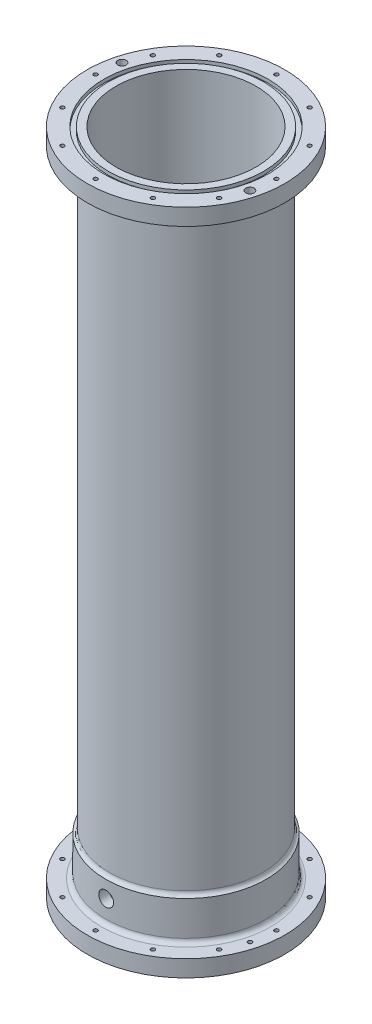
from build123d import *

# Parameters (mm, degrees)
SKETCH2_R               = 43.815
SKETCH2_R_2             = 40
BASE_CYLINDER_DEPTH     = 381
SKETCH3_R               = 56.35625
SKETCH3_R_2             = 40
AFT_FLANGE_DEPTH        = 9.525
SKETCH6_R               = 46.9011
SKETCH6_R_2             = 44.2849
AFT_O_RING_DEPTH        = 1.9812
SKETCH33_R              = 45.72
SKETCH33_R_2            = 43.815
CRITICALBOSS_DEPTH      = 22.225
FILLET1_R               = 2.54
BOLT_CIRCLE_D           = 2.2606
BOLT_CIRCLE_DEPTH       = 381
HOLE1_D                 = 2.38125
HOLE1_DEPTH             = 381
HOLE1_CBORE_D           = 4.7625
HOLE1_CBORE_DEPTH       = 4.7625
F_3_8_24_TAPPED_HOLE1_D = 8.4328
FILLET2_R               = 2.54


with BuildPart() as part:
    # Sketch2 → Base Cylinder (new body)
    with BuildSketch(Plane(origin=(0, 0, 0), x_dir=(1, 0, 0), z_dir=(0, 1, 0))):
        with Locations(Location((0, 0, 0), (0, 0, 270))):
            Circle(SKETCH2_R)
        with Locations(Location((0, 0, 0), (0, 0, 270))):
            Circle(SKETCH2_R_2, mode=Mode.SUBTRACT)
    extrude(amount=BASE_CYLINDER_DEPTH)

    # Sketch3 → Aft Flange (add)
    with BuildSketch(Plane.XZ):
        with Locations(Location((0, 0, 0), (0, 0, 270))):
            Circle(SKETCH3_R)
        with Locations(Location((0, 0, 0), (0, 0, 90))):
            Circle(SKETCH3_R_2, mode=Mode.SUBTRACT)
    aft_flange = extrude(amount=-AFT_FLANGE_DEPTH)

    # Sketch6 → Aft O-Ring (cut)
    with BuildSketch(Plane.XZ):
        with Locations(Location((0, 0, 0), (0, 0, 270))):
            Circle(SKETCH6_R)
        with Locations(Location((0, 0, 0), (0, 0, 270))):
            Circle(SKETCH6_R_2, mode=Mode.SUBTRACT)
    aft_o_ring = extrude(amount=-AFT_O_RING_DEPTH, mode=Mode.SUBTRACT)

    # Sketch33 → CriticalBoss (add)
    with BuildSketch(Plane(origin=(0, 9.525, 0), x_dir=(1, 0, 0), z_dir=(0, 1, 0))):
        with Locations(Location((0, 0, 0), (0, 0, 90))):
            Circle(SKETCH33_R)
        with Locations(Location((0, 0, 0), (0, 0, 270))):
            Circle(SKETCH33_R_2, mode=Mode.SUBTRACT)
    extrude(amount=CRITICALBOSS_DEPTH)

    # Fillet1
    # the kernel refuses this fillet: 2.54 mm, written as the material it adds along each edge
    with BuildSketch(Plane(origin=(0, 9.525, 0), x_dir=(0, 0, -1), z_dir=(1, 0, 0))) as fillet1_piece_1:
        with BuildLine():
            CenterArc((45.72 + FILLET1_R, FILLET1_R), FILLET1_R, 180, 90)
            Line((45.72, FILLET1_R), (45.72 - FILLET1_R * 0.02, FILLET1_R))
            Line((45.72 - FILLET1_R * 0.02, FILLET1_R), (45.72 - FILLET1_R * 0.02, -FILLET1_R * 0.02))
            Line((45.72 - FILLET1_R * 0.02, -FILLET1_R * 0.02), (45.72 + FILLET1_R, -FILLET1_R * 0.02))
            Line((45.72 + FILLET1_R, -FILLET1_R * 0.02), (45.72 + FILLET1_R, 0))
        make_face()
    revolve(axis=Axis((0, 9.525, 0), (0, 1, 0)))
    with BuildSketch(Plane(origin=(0, 31.75, 0), x_dir=(0, 0, 1), z_dir=(-1, 0, 0))) as fillet1_piece_2:
        with BuildLine():
            CenterArc((46.355, 2.459344425), FILLET1_R, 180, 75.522487814)
            Line((43.815, 2.459344425), (43.7642, 2.459344425))
            Line((43.7642, 2.459344425), (43.7642, 0))
            Line((43.7642, 0), (43.815, -0.0508))
            ThreePointArc((43.815, -0.0508), (44.7675, -0.0508), (45.7073, -0.049186888))
            Line((45.7073, -0.049186888), (45.72, 0))
        make_face()
    revolve(axis=Axis((0, 31.75, 0), (0, 1, 0)))

    # Bolt Circle
    with Locations(Plane(origin=(0, 0, 0), x_dir=(-1, 0, 0), z_dir=(0, -1, 0))):
        with Locations((-25.81275, -44.708994483), (-44.708994483, -25.81275), (-51.6255, 0), (-44.708994483, 25.81275), (-25.81275, 44.708994483), (0, 51.6255), (25.81275, 44.708994483), (44.708994483, 25.81275), (51.6255, 0), (44.708994483, -25.81275), (25.81275, -44.708994483), (0, -51.6255)):
            bolt_circle = Hole(BOLT_CIRCLE_D / 2, depth=BOLT_CIRCLE_DEPTH)

    # Hole1
    with Locations(Plane(origin=(0, 0, 0), x_dir=(-1, 0, 0), z_dir=(0, -1, 0))):
        with Locations((49.866403745, 13.361662613), (-49.866403745, -13.361662613)):
            hole1 = CounterBoreHole(HOLE1_D / 2, HOLE1_CBORE_D / 2, HOLE1_CBORE_DEPTH, depth=HOLE1_DEPTH)

    # Sketch44 → 1/8 NPT Tapped ThermocoupleHole (revolve, cut)
    with BuildSketch(Plane(origin=(0, 22.225, -45.72), x_dir=(0, 1, 0), z_dir=(1, 0, 0))):
        Polygon((0, 0), (0, 14.217468714), (4.2164, 11.684), (4.2164, 6.858), (4.936181096, 6.858), (5.1415188, 0), align=None)
    revolve(axis=Axis((0, 22.225, -52.07), (0, 0, 1)), mode=Mode.SUBTRACT)

    # 3/8-24 Tapped Hole1 (through all)
    with Locations(Plane.XY.offset(45.72)):
        with Locations((0, 22.225)):
            Hole(F_3_8_24_TAPPED_HOLE1_D / 2)

    # Mirror1: Aft Flange, Aft O-Ring, Bolt Circle, Hole1 across plane
    add(aft_flange.mirror(Plane.ZX.offset(190.5)))
    add(aft_o_ring.mirror(Plane.ZX.offset(190.5)), mode=Mode.SUBTRACT)
    add(bolt_circle.mirror(Plane.ZX.offset(190.5)), mode=Mode.SUBTRACT)
    add(hole1.mirror(Plane.ZX.offset(190.5)), mode=Mode.SUBTRACT)

    # Fillet2
    fillet2_edges = [part.edges().sort_by_distance(p)[0] for p in [
        (0, 371.475, -43.815),
    ]]
    fillet(fillet2_edges, radius=FILLET2_R)


solid = part.part
